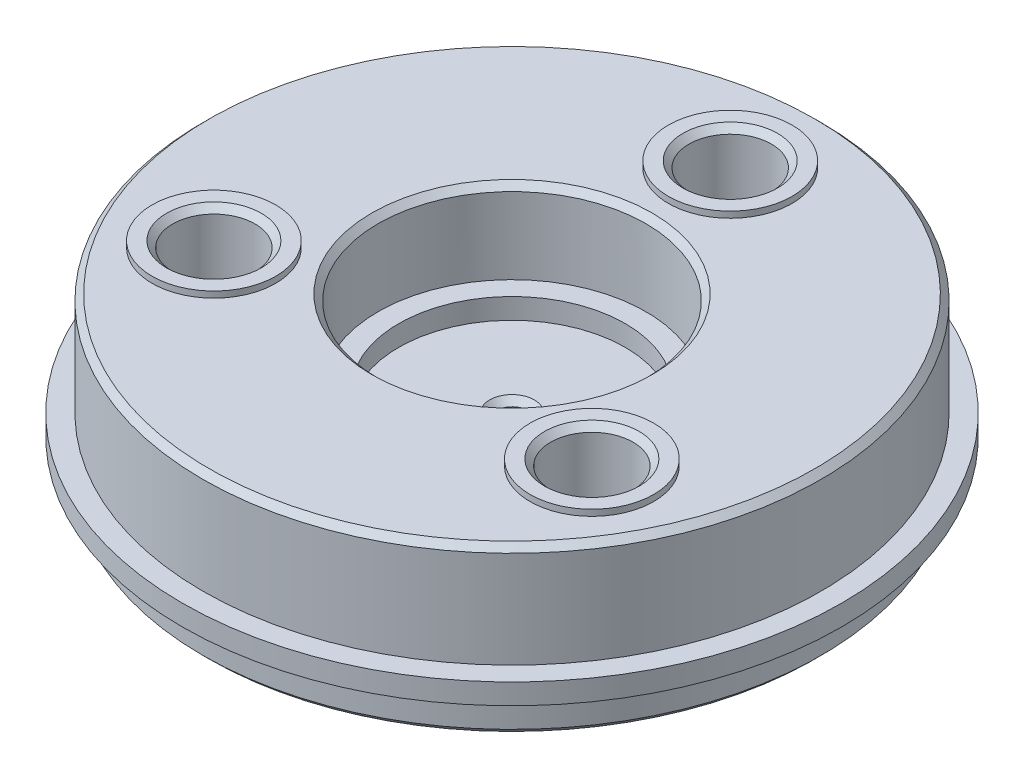
from build123d import *

# Parameters (mm, degrees)
PATTERN_CIRCULAR_2_COUNT = 6
SKETCH_8_R               = 2
CUT_EXTRUDE_1_DEPTH      = 3.7
PATTERN_CIRCULAR_3_COUNT = 3
CHAMFER_1_SIZE           = 0.3
CHAMFER_3_SIZE           = 0.3
EXTRUDE_START            = 0.3
SKETCH_12_R              = 3
SKETCH_12_R_2            = 2
EXTRUDE_1_DEPTH          = 0.3
CHAMFER_4_SIZE           = 0.3
EXTRUDE_START_2          = 3
SKETCH_13_R              = 0.785
EXTRUDE_2_DEPTH          = 3
CHAMFER_5_SIZE           = 0.3
SKETCH_14_R              = 0.75
CUT_EXTRUDE_2_DEPTH      = 24.775828061


with BuildPart() as part:
    # 草图1 → 旋转1 (revolve)
    with BuildSketch(Plane.XY, mode=Mode.PRIVATE) as revolve_1_sk:
        Polygon((16, 3), (15, 3), (15, 8), (6.5, 8), (6.5, 4), (5.5, 4), (5.5, 3), (0.785, 3), (0.785, 0), (15, 0), (15, 2), (16, 2), align=None)
    revolve(revolve_1_sk.sketch.rotate(Axis((0, 0, 0), (0, -1, 0)), 90), axis=Axis((0, 0, 0), (0, -1, 0)))

    # 草图7 → M3 螺纹孔2 (revolve, cut)
    with BuildSketch(Plane(origin=(-12, 0, 0), x_dir=(0, 0, -1), z_dir=(1, 0, 0))):
        Polygon((0, 0), (0, 7.5), (1.25, 6.748924226), (1.25, 0), align=None)
    hole_wizard_m3_2 = revolve(axis=Axis((-12, -6.35, 0), (0, 1, 0)), mode=Mode.SUBTRACT)

    # 阵列(圆周)2: M3 螺纹孔2 ×6 about axis
    pattern_circular_2_axis = Axis((0, 0, 0), (0, 1, 0))
    for i in range(1, PATTERN_CIRCULAR_2_COUNT):
        add(hole_wizard_m3_2.rotate(pattern_circular_2_axis, i * 360 / PATTERN_CIRCULAR_2_COUNT), mode=Mode.SUBTRACT)

    # 草图8 → 切除-拉伸1 (cut)
    with BuildSketch(Plane(origin=(0, 8, 0), x_dir=(1, 0, 0), z_dir=(0, 1, 0))):
        with Locations(Location((0, 10.59, 0), (0, 0, 270))):
            Circle(SKETCH_8_R)
    cut_extrude_1 = extrude(amount=-CUT_EXTRUDE_1_DEPTH, mode=Mode.SUBTRACT)

    # 阵列(圆周)3: 切除-拉伸1 ×3 about axis
    pattern_circular_3_axis = Axis((0, 0, 0), (0, 1, 0))
    for i in range(1, PATTERN_CIRCULAR_3_COUNT):
        add(cut_extrude_1.rotate(pattern_circular_3_axis, i * 360 / PATTERN_CIRCULAR_3_COUNT), mode=Mode.SUBTRACT)

    # 倒角1
    chamfer_1_edges = [part.edges().sort_by_distance(p)[0] for p in [
        (0, 0, -15),
        (0, 8, -15),
        (0, 8, -6.5),
    ]]
    chamfer(chamfer_1_edges, length=CHAMFER_1_SIZE)

    # 倒角3
    chamfer_3_edges = [part.edges().sort_by_distance(p)[0] for p in [
        (0, 3, -0.785),
    ]]
    chamfer(chamfer_3_edges, length=CHAMFER_3_SIZE)

    # 草图12 → 凸台-拉伸1 (add)
    # profile 1 of 3: a face of its own
    with BuildSketch(Plane(origin=(0, 8, 0), x_dir=(1, 0, 0), z_dir=(0, 1, 0)).offset(EXTRUDE_START)):
        with Locations(Location((0, 10.59, 0), (0, 0, 90))):
            Circle(SKETCH_12_R)
        with Locations(Location((0, 10.59, 0), (0, 0, 270))):
            Circle(SKETCH_12_R_2, mode=Mode.SUBTRACT)
    # profile 2 of 3: a face of its own
    with BuildSketch(Plane(origin=(0, 8, 0), x_dir=(1, 0, 0), z_dir=(0, 1, 0)).offset(EXTRUDE_START)):
        with Locations(Location((-9.171209026, -5.295, 0), (0, 0, 90))):
            Circle(SKETCH_12_R)
        with Locations(Location((-9.171209026, -5.295, 0), (0, 0, 270))):
            Circle(SKETCH_12_R_2, mode=Mode.SUBTRACT)
    # profile 3 of 3: a face of its own
    with BuildSketch(Plane(origin=(0, 8, 0), x_dir=(1, 0, 0), z_dir=(0, 1, 0)).offset(EXTRUDE_START)):
        with Locations(Location((9.171209026, -5.295, 0), (0, 0, 90))):
            Circle(SKETCH_12_R)
        with Locations(Location((9.171209026, -5.295, 0), (0, 0, 270))):
            Circle(SKETCH_12_R_2, mode=Mode.SUBTRACT)
    extrude(amount=-EXTRUDE_1_DEPTH)

    # 倒角4
    # the kernel refuses this chamfer: 0.3 mm, written as the material it takes off along each edge
    with BuildSketch(Plane(origin=(9.171209026, 8.3, 5.295), x_dir=(0, 0, 1), z_dir=(-1, 0, 0))) as chamfer_4_piece_1:
        Polygon((2 + CHAMFER_4_SIZE, 0), (2, -CHAMFER_4_SIZE), (2, 0), align=None)
    revolve(axis=Axis((9.171209026, 8.3, 5.295), (0, 1, 0)), mode=Mode.SUBTRACT)
    with BuildSketch(Plane(origin=(0, 8.3, -10.59), x_dir=(0, 0, 1), z_dir=(-1, 0, 0))) as chamfer_4_piece_2:
        Polygon((2 + CHAMFER_4_SIZE, 0), (2, -CHAMFER_4_SIZE), (2, 0), align=None)
    revolve(axis=Axis((0, 8.3, -10.59), (0, 1, 0)), mode=Mode.SUBTRACT)
    with BuildSketch(Plane(origin=(-9.171209026, 8.3, 5.295), x_dir=(0, 0, 1), z_dir=(-1, 0, 0))) as chamfer_4_piece_3:
        Polygon((2 + CHAMFER_4_SIZE, 0), (2, -CHAMFER_4_SIZE), (2, 0), align=None)
    revolve(axis=Axis((-9.171209026, 8.3, 5.295), (0, 1, 0)), mode=Mode.SUBTRACT)

    # 草图13 → 凸台-拉伸2 (add)
    with BuildSketch(Plane.XZ.offset(EXTRUDE_START_2)):
        with BuildLine():
            Line((-3, 6.92820323), (-3, -6.92820323))
            ThreePointArc((-3, -6.92820323), (-2.511857892, -8.237510572), (-1.285714286, -8.907689867))
            ThreePointArc((-1.285714286, -8.907689867), (0, -9), (1.285714286, -8.907689867))
            ThreePointArc((1.285714286, -8.907689867), (2.511857892, -8.237510572), (3, -6.92820323))
            Line((3, -6.92820323), (3, 6.92820323))
            ThreePointArc((3, 6.92820323), (2.511857892, 8.237510572), (1.285714286, 8.907689867))
            ThreePointArc((1.285714286, 8.907689867), (0, 9), (-1.285714286, 8.907689867))
            ThreePointArc((-1.285714286, 8.907689867), (-2.511857892, 8.237510572), (-3, 6.92820323))
        make_face()
        with Locations(Location((0, 0, 0), (0, 0, 270))):
            Circle(SKETCH_13_R, mode=Mode.SUBTRACT)
    extrude(amount=-EXTRUDE_2_DEPTH)

    # 倒角5
    chamfer_5_edges = [part.edges().sort_by_distance(p)[0] for p in [
        (-2.511857892, -3, -8.237510572),
        (0, -3, -9),
        (2.511857892, -3, -8.237510572),
        (3, -3, 0),
        (2.511857892, -3, 8.237510572),
        (0, -3, 9),
        (-2.511857892, -3, 8.237510572),
        (-3, -3, 0),
    ]]
    chamfer(chamfer_5_edges, length=CHAMFER_5_SIZE)

    # 草图14 → 切除-拉伸2 (cut, through all)
    with BuildSketch(Plane(origin=(0, 4.3, 0), x_dir=(1, 0, 0), z_dir=(0, 1, 0))):
        with Locations(Location((9.171209026, -5.295, 0), (0, 0, 270))):
            Circle(SKETCH_14_R)
        with Locations(Location((0, 10.59, 0), (0, 0, 270))):
            Circle(SKETCH_14_R)
        with Locations(Location((-9.171209026, -5.295, 0), (0, 0, 270))):
            Circle(SKETCH_14_R)
    extrude(amount=-CUT_EXTRUDE_2_DEPTH, mode=Mode.SUBTRACT)


solid = part.part
